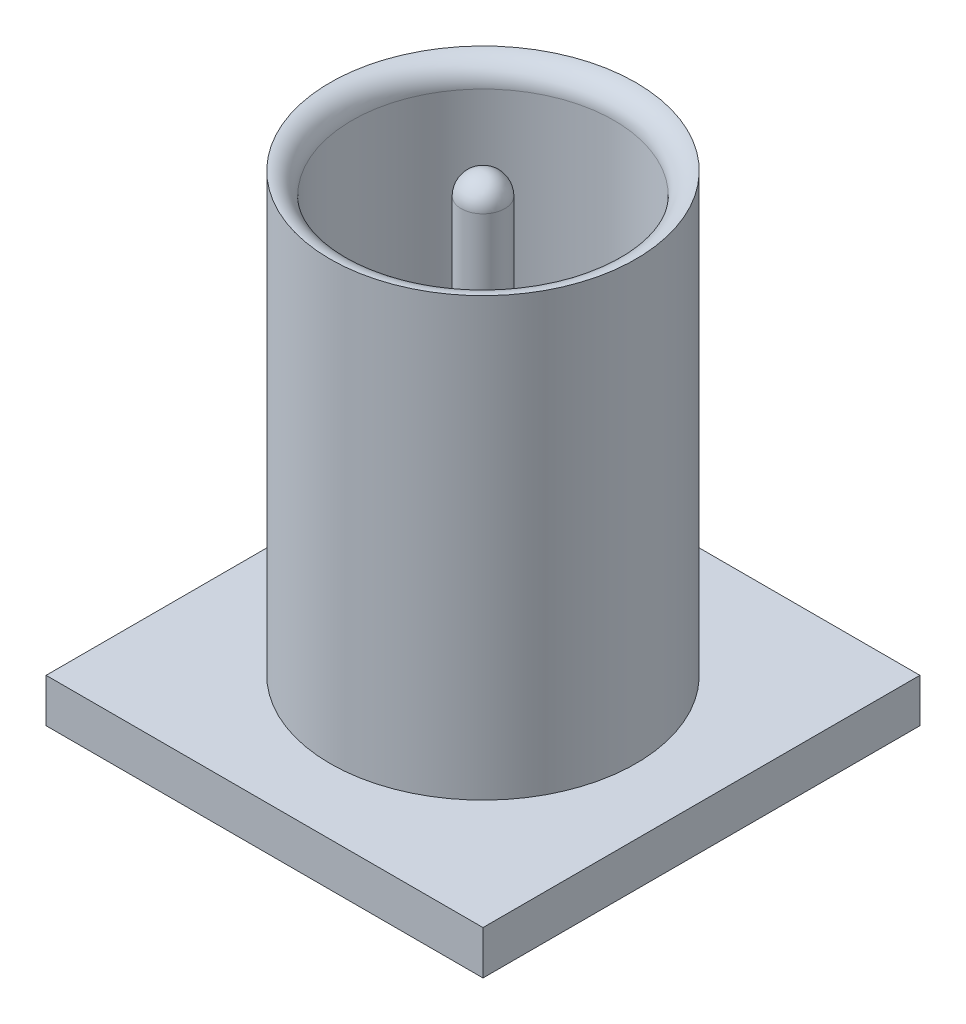
from build123d import *

# Parameters (mm, degrees)
SKETCH1_R           = 3.5
BOSS_EXTRUDE1_DEPTH = 10
SKETCH2_R           = 3
CUT_EXTRUDE1_DEPTH  = 9
SKETCH3_R           = 0.5
BOSS_EXTRUDE2_DEPTH = 9
FILLET1_R           = 0.5
SKETCH4_W           = 10
SKETCH4_H           = 10
BOSS_EXTRUDE3_DEPTH = 1


with BuildPart() as part:
    # Sketch1 → Boss-Extrude1 (new body)
    with BuildSketch(Plane(origin=(0, 0, 0), x_dir=(1, 0, 0), z_dir=(0, 1, 0))):
        with Locations(Location((0, 0, 0), (0, 0, 270))):
            Circle(SKETCH1_R)
    extrude(amount=BOSS_EXTRUDE1_DEPTH)

    # Sketch2 → Cut-Extrude1 (cut)
    with BuildSketch(Plane(origin=(0, 10, 0), x_dir=(1, 0, 0), z_dir=(0, 1, 0))):
        with Locations(Location((0, 0, 0), (0, 0, 270))):
            Circle(SKETCH2_R)
    extrude(amount=-CUT_EXTRUDE1_DEPTH, mode=Mode.SUBTRACT)

    # Sketch3 → Boss-Extrude2 (add)
    with BuildSketch(Plane(origin=(0, 1, 0), x_dir=(1, 0, 0), z_dir=(0, 1, 0))):
        with Locations(Location((0, 0, 0), (0, 0, 270))):
            Circle(SKETCH3_R)
    extrude(amount=BOSS_EXTRUDE2_DEPTH)

    # Fillet1
    fillet1_edges = [part.edges().sort_by_distance(p)[0] for p in [
        (0, 10, -0.5),
        (0, 10, -3),
    ]]
    fillet(fillet1_edges, radius=FILLET1_R - 0.0001)  # a hair under: the kernel refuses the full size

    # Sketch4 → Boss-Extrude3 (add)
    with BuildSketch(Plane(origin=(0, 0, 0), x_dir=(-1, 0, 0), z_dir=(0, -1, 0))):
        Rectangle(SKETCH4_W, SKETCH4_H)
    extrude(amount=BOSS_EXTRUDE3_DEPTH)


solid = part.part
